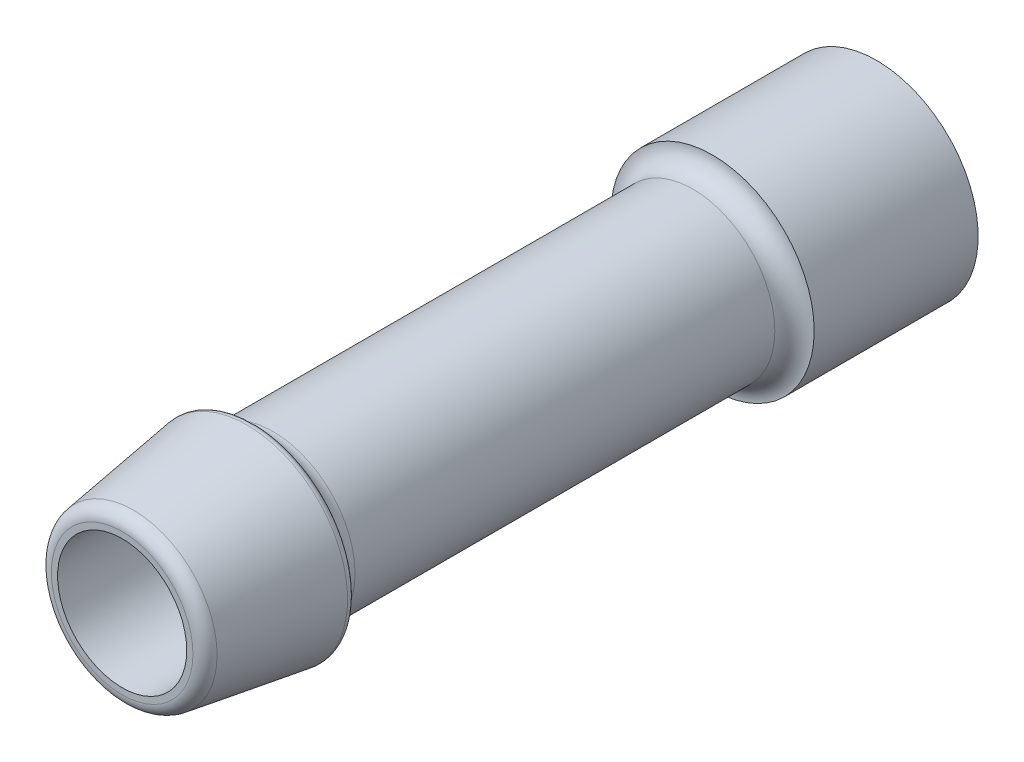
from build123d import *

# Parameters (mm, degrees)
SKETCH1_R           = 3.937
BOSS_EXTRUDE1_DEPTH = 29.21
SKETCH2_R           = 2.5
CUT_EXTRUDE1_START  = -5.08
SKETCH3_R           = 5.08
SKETCH3_R_2         = 3.175
CUT_EXTRUDE1_DEPTH  = 17.78
FILLET1_R           = 0.762
FILLET2_R           = 0.762
CHAMFER1_SIZE       = 5.08
CHAMFER1_SIZE_2     = 0.759211087
FILLET3_R           = 0.254
FILLET4_R           = 0.508


# Some blends are built 0.0001 mm under size
with BuildPart() as part:
    # Sketch1 → Boss-Extrude1 (new body)
    with BuildSketch(Plane.XY):
        with Locations(Location((0, 0, 0), (0, 0, 180))):
            Circle(SKETCH1_R)
    extrude(amount=BOSS_EXTRUDE1_DEPTH)

    # Cut-Sweep1: sweep along a curve in space
    with BuildLine() as cut_sweep1_path:
        Line((0, 0, 29.21), (0, 0, 0))
    # Sketch2 → Cut-Sweep1 (sweep, cut)
    with BuildSketch(Plane.XY.offset(29.21)):
        Circle(SKETCH2_R)
    sweep(path=cut_sweep1_path.line, mode=Mode.SUBTRACT)

    # Sketch3 → Cut-Extrude1 (cut)
    with BuildSketch(Plane.XY.offset(29.21).offset(CUT_EXTRUDE1_START)):
        Circle(SKETCH3_R)
        Circle(SKETCH3_R_2, mode=Mode.SUBTRACT)
    extrude(amount=-CUT_EXTRUDE1_DEPTH, mode=Mode.SUBTRACT)

    # Fillet1
    fillet1_edges = [part.edges().sort_by_distance(p)[0] for p in [
        (-3.175, 0, 6.35),
    ]]
    fillet(fillet1_edges, radius=FILLET1_R - 0.0001)  # a hair under: the kernel refuses the full size

    # Fillet2
    fillet2_edges = [part.edges().sort_by_distance(p)[0] for p in [
        (-3.175, 0, 24.13),
    ]]
    fillet(fillet2_edges, radius=FILLET2_R - 0.0001)  # a hair under: the kernel refuses the full size

    # Chamfer1
    # the kernel refuses this chamfer: 5.08, 0.759211087 mm, written as the material it takes off along each edge
    with BuildSketch(Plane(origin=(0, 0, 29.21), x_dir=(-1, 0, 0), z_dir=(0, 1, 0))) as chamfer1_piece_1:
        Polygon((3.937, -CHAMFER1_SIZE), (3.937 - CHAMFER1_SIZE_2, 0), (3.937, 0), align=None)
    revolve(axis=Axis((0, 0, 29.21), (0, 0, 1)), mode=Mode.SUBTRACT)

    # Fillet3
    fillet3_edges = [part.edges().sort_by_distance(p)[0] for p in [
        (3.937, 0, 24.13),
    ]]
    fillet(fillet3_edges, radius=FILLET3_R)

    # Fillet4
    fillet4_edges = [part.edges().sort_by_distance(p)[0] for p in [
        (3.177788913, 0, 29.21),
    ]]
    fillet(fillet4_edges, radius=FILLET4_R)


solid = part.part
